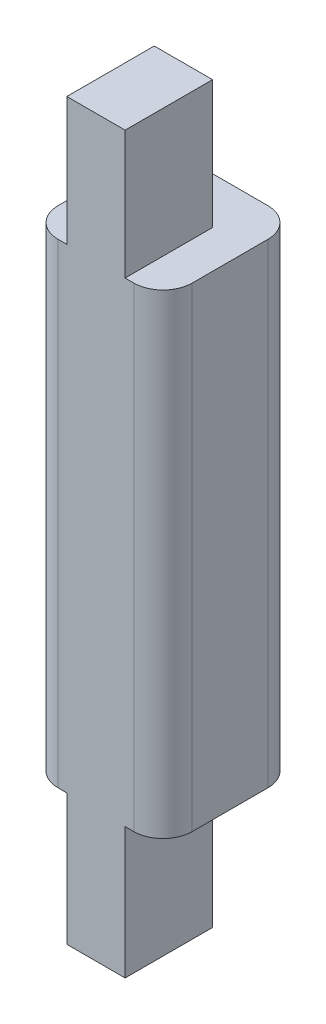
from build123d import *

# Parameters (mm, degrees)
SKETCH2_W           = 23
SKETCH2_H           = 23
BOSS_EXTRUDE1_DEPTH = 81.5
SKETCH2_3_W         = 10
SKETCH2_3_H         = 15
BOSS_EXTRUDE2_DEPTH = 22.5
FILLET1_R           = 5


with BuildPart() as part:
    # Sketch2 → Boss-Extrude1 (new body)
    with BuildSketch(Plane(origin=(0, 0, 0), x_dir=(1, 0, 0), z_dir=(0, 1, 0))):
        Rectangle(SKETCH2_W, SKETCH2_H)
    extrude(amount=BOSS_EXTRUDE1_DEPTH)

    # Sketch2<3> → Boss-Extrude2 (add)
    with BuildSketch(Plane(origin=(0, 0, 0), x_dir=(1, 0, 0), z_dir=(0, 1, 0))):
        with Locations((0, -4)):
            Rectangle(SKETCH2_3_W, SKETCH2_3_H)
    boss_extrude2 = extrude(amount=-BOSS_EXTRUDE2_DEPTH)

    # Fillet1
    fillet1_edges = [part.edges().sort_by_distance(p)[0] for p in [
        (-11.5, 40.75, 11.5),
        (11.5, 40.75, 11.5),
        (-11.5, 40.75, -11.5),
        (11.5, 40.75, -11.5),
    ]]
    fillet(fillet1_edges, radius=FILLET1_R)

    # Mirror1: Boss-Extrude2 across plane
    add(boss_extrude2.mirror(Plane.ZX.offset(40.486123935)))


solid = part.part
